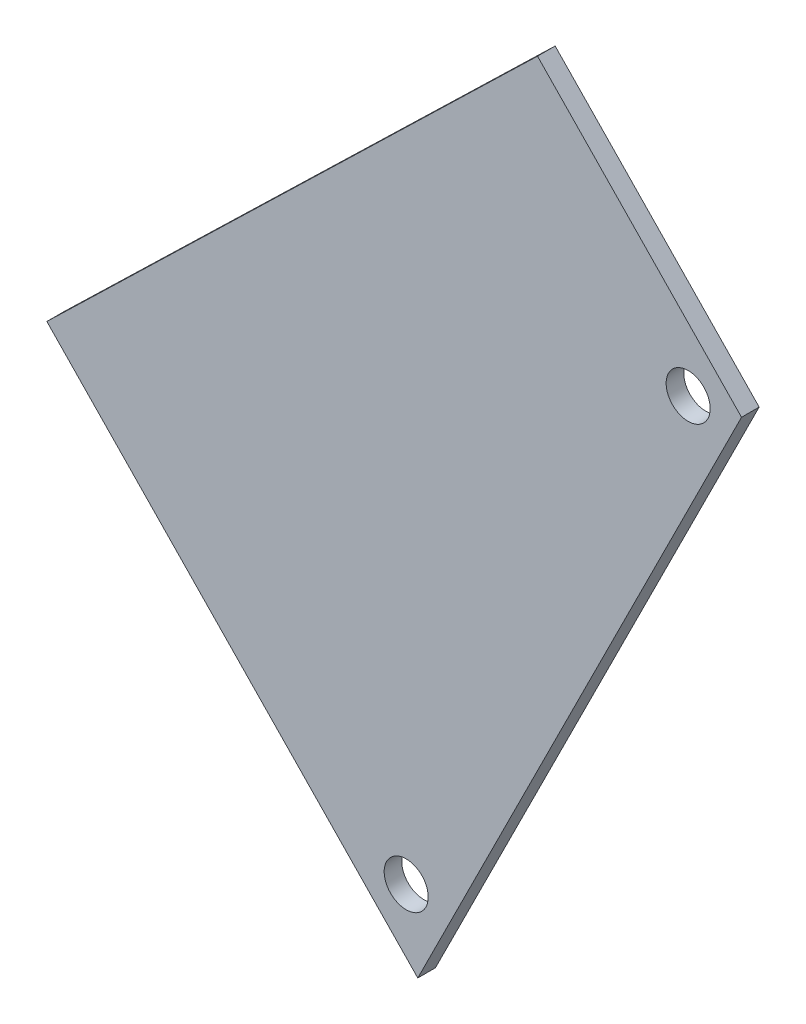
from build123d import *

# Parameters (mm, degrees)
SKETCH1_R           = 3.175
BOSS_EXTRUDE3_DEPTH = 2.54


with BuildPart() as part:
    # Sketch1 → Boss-Extrude3 (new body)
    with BuildSketch(Plane.XY):
        Polygon((-12.628154113, 82.464660116), (-23.460387201, 93.651920065), (-42.031929204, 112.83214508), (-112.74974727, 44.358551699), (-59.28812357, -10.855278797), align=None)
        with Locations((-60.96, 0)):
            Circle(SKETCH1_R, mode=Mode.SUBTRACT)
        with Locations((-20.32, 81.28)):
            Circle(SKETCH1_R, mode=Mode.SUBTRACT)
    extrude(amount=BOSS_EXTRUDE3_DEPTH)


solid = part.part
